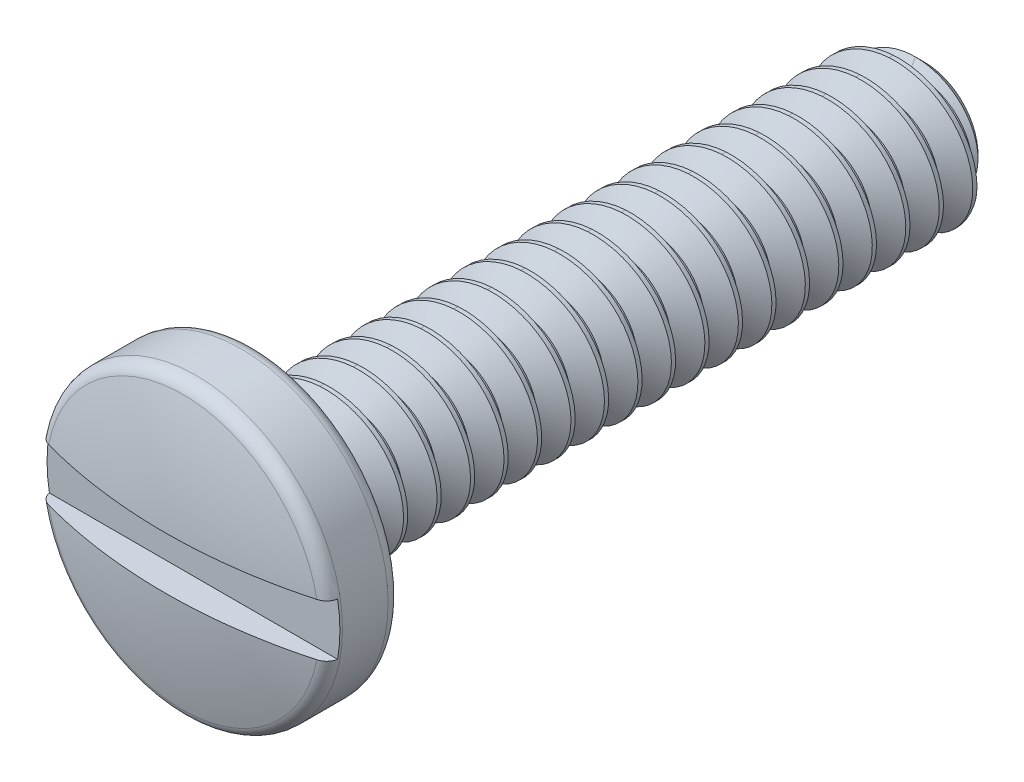
from build123d import *

# Parameters (mm, degrees)
SKETCH3_W               = 12.7
SKETCH3_H               = 1.009955401
SWEEP1_PITCH            = 0.635
SWEEP2_PITCH            = 0.635
SKETCH10_W              = 254
SKETCH10_H              = 12.7
SKETCH8_W               = 1.7272
SKETCH8_H               = 2.7813
SKETCH12_W              = 5.5626
SKETCH12_H              = 0.9906
CUT_EXTRUDE_THIN2_DEPTH = 0.5588


with BuildPart() as part:
    # Sketch3 → Revolve1 (revolve)
    with BuildSketch(Plane(origin=(0, 0, 0), x_dir=(0, 0, -1), z_dir=(1, 0, 0)), mode=Mode.PRIVATE) as revolve1_sk:
        with Locations((-6.35, 0.504977701)):
            Rectangle(SKETCH3_W, SKETCH3_H)
    revolve(revolve1_sk.sketch.rotate(Axis((0, 0, 0), (0, 0, -1)), 90), axis=Axis((0, 0, 0), (0, 0, -1)))

    # Sweep1: the profile of Sketch2 profile screwed along a right-hand helix of 21 turns, 6 arcs to a turn; built about Z, then put on its axis
    sweep1_z = Axis((0, 0, 0), (0, 0, 1))
    sweep1_corners = [(1.4224, 0, 0.0396875), (1.4224, 0, -0.0396875), (1.009655401, 0, -0.277985705), (1.009655401, 0, 0.277985705)]
    with BuildLine(mode=Mode.PRIVATE) as sweep1_profile:
        Line(sweep1_corners[0], sweep1_corners[1])
        Line(sweep1_corners[1], sweep1_corners[2])
        Line(sweep1_corners[2], sweep1_corners[3])
        Line(sweep1_corners[3], sweep1_corners[0])
    sweep1_cap = Face(sweep1_profile.wire())
    sweep1_turn_angles = [0, 30, 60, 90, 120, 150, 180, 210, 240, 270, 300, 330, 360]
    sweep1_turn_weights = [1, 0.8660254037844387, 1, 0.8660254037844387, 1, 0.8660254037844387, 1, 0.8660254037844387, 1, 0.8660254037844387, 1, 0.8660254037844387, 1]
    sweep1_turn_rails = [Edge.make_bspline([Vector(p[0], p[1], 0).rotate(sweep1_z, sweep1_turn_angles[k]) / sweep1_turn_weights[k] + Vector(0, 0, p[2] + SWEEP1_PITCH * sweep1_turn_angles[k] / 360) for k in range(13)], [0, 0, 0, 1, 1, 2, 2, 3, 3, 4, 4, 5, 5, 6, 6, 6], 2, sweep1_turn_weights) for p in sweep1_corners]
    sweep1_turn_sides = [Face.make_surface_from_curves(sweep1_turn_rails[p[0]], sweep1_turn_rails[p[1]]) for p in [(0, 1), (1, 2), (2, 3), (3, 0)]]
    sweep1 = Plane(origin=(0, 0, 0), x_dir=(0, 1, 0), z_dir=(0, 0, 1)) * Solid(Shell([*[p.moved(Location((0, 0, SWEEP1_PITCH * i))) for i in range(21) for p in sweep1_turn_sides], sweep1_cap, sweep1_cap.rotate(sweep1_z, 7560).moved(Location((0, 0, SWEEP1_PITCH * 7560 / 360)))]))
    add(sweep1)

    # Sweep2: the profile of Sketch6 screwed along a right-hand helix of 1 turns, 6 arcs to a turn; built about Z, then put on its axis
    sweep2_z = Axis((0, 0, 0), (0, 0, 1))
    sweep2_corners = [(1.4224, 0, -0.0396875), (1.009955401, 0, -0.2778125), (1.009955401, 0, 0), (1.009955401, 0, 0.2778125), (1.4224, 0, 0.0396875)]
    with BuildLine(mode=Mode.PRIVATE) as sweep2_profile:
        Line(sweep2_corners[0], sweep2_corners[1])
        Line(sweep2_corners[1], sweep2_corners[2])
        Line(sweep2_corners[2], sweep2_corners[3])
        Line(sweep2_corners[3], sweep2_corners[4])
        Line(sweep2_corners[4], sweep2_corners[0])
    sweep2_cap = Face(sweep2_profile.wire())
    sweep2_turn_angles = [0, 30, 60, 90, 120, 150, 180, 210, 240, 270, 300, 330, 360]
    sweep2_turn_weights = [1, 0.8660254037844387, 1, 0.8660254037844387, 1, 0.8660254037844387, 1, 0.8660254037844387, 1, 0.8660254037844387, 1, 0.8660254037844387, 1]
    sweep2_turn_rails = [Edge.make_bspline([Vector(p[0], p[1], 0).rotate(sweep2_z, sweep2_turn_angles[k]) / sweep2_turn_weights[k] + Vector(0, 0, p[2] + SWEEP2_PITCH * sweep2_turn_angles[k] / 360) for k in range(13)], [0, 0, 0, 1, 1, 2, 2, 3, 3, 4, 4, 5, 5, 6, 6, 6], 2, sweep2_turn_weights) for p in sweep2_corners]
    sweep2_turn_sides = [Face.make_surface_from_curves(sweep2_turn_rails[p[0]], sweep2_turn_rails[p[1]]) for p in [(0, 1), (1, 2), (2, 3), (3, 4), (4, 0)]]
    sweep2 = Plane(origin=(0, 0, 0), x_dir=(0, 1, 0), z_dir=(0, 0, -1)) * Solid(Shell([*sweep2_turn_sides, sweep2_cap, sweep2_cap.rotate(sweep2_z, 360).moved(Location((0, 0, SWEEP2_PITCH * 360 / 360)))]))
    add(sweep2)

    # Sketch4 → Cut-Revolve1 (revolve, cut)
    with BuildSketch(Plane(origin=(0, 0, 0), x_dir=(0, 0, -1), z_dir=(1, 0, 0))):
        Polygon((0, 1.009955401), (-3.175, 4.184955401), (2.54, 4.184955401), (2.54, 0), (0, 0), align=None)
    revolve(axis=Axis((0, 0, -2.54), (0, 0, -1)), mode=Mode.SUBTRACT)

    # Sketch10 → Cut-Revolve2 (revolve, cut)
    with BuildSketch(Plane(origin=(0, 0, 0), x_dir=(0, 0, -1), z_dir=(1, 0, 0))):
        with Locations((-139.7, 6.35)):
            Rectangle(SKETCH10_W, SKETCH10_H)
    revolve(axis=Axis((0, 0, 0), (0, 0, -1)), mode=Mode.SUBTRACT)

    # Sketch8 → Revolve2 (revolve)
    with BuildSketch(Plane(origin=(0, 0, 0), x_dir=(0, 0, -1), z_dir=(1, 0, 0)), mode=Mode.PRIVATE) as revolve2_sk:
        with Locations((-13.5636, 1.39065)):
            Rectangle(SKETCH8_W, SKETCH8_H)
    revolve(revolve2_sk.sketch.rotate(Axis((0, 0, 0), (0, 0, 1)), 90), axis=Axis((0, 0, 0), (0, 0, 1)))

    # Sketch11 → Cut-Revolve3 (revolve, cut)
    with BuildSketch(Plane(origin=(0, 0, 0), x_dir=(0, 0, -1), z_dir=(1, 0, 0)), mode=Mode.PRIVATE) as cut_revolve3_sk:
        with BuildLine():
            Line((-13.82268, 2.7813), (-12.95908, 2.7813))
            ThreePointArc((-12.95908, 2.7813), (-12.775882775, 2.705417225), (-12.7, 2.52222))
            Line((-12.7, 2.52222), (-12.065, 2.52222))
            Line((-12.065, 2.52222), (-12.065, 3.4163))
            Line((-12.065, 3.4163), (-15.0622, 3.4163))
            Line((-15.0622, 3.4163), (-15.0622, 0))
            Line((-15.0622, 0), (-14.4272, 0))
            ThreePointArc((-14.4272, 0), (-14.338042563, 1.308037884), (-14.072219474, 2.591879868))
            ThreePointArc((-14.072219474, 2.591879868), (-13.979324451, 2.728581243), (-13.82268, 2.7813))
        make_face()
    revolve(cut_revolve3_sk.sketch.rotate(Axis((0, 0, 14.4272), (0, 0, -1)), 180), axis=Axis((0, 0, 14.4272), (0, 0, -1)), mode=Mode.SUBTRACT)

    # Sketch12 → Cut-Extrude-Thin2 (cut)
    with BuildSketch(Plane.XY.offset(14.4272)):
        Rectangle(SKETCH12_W, SKETCH12_H)
    extrude(amount=-CUT_EXTRUDE_THIN2_DEPTH, mode=Mode.SUBTRACT)


solid = part.part
